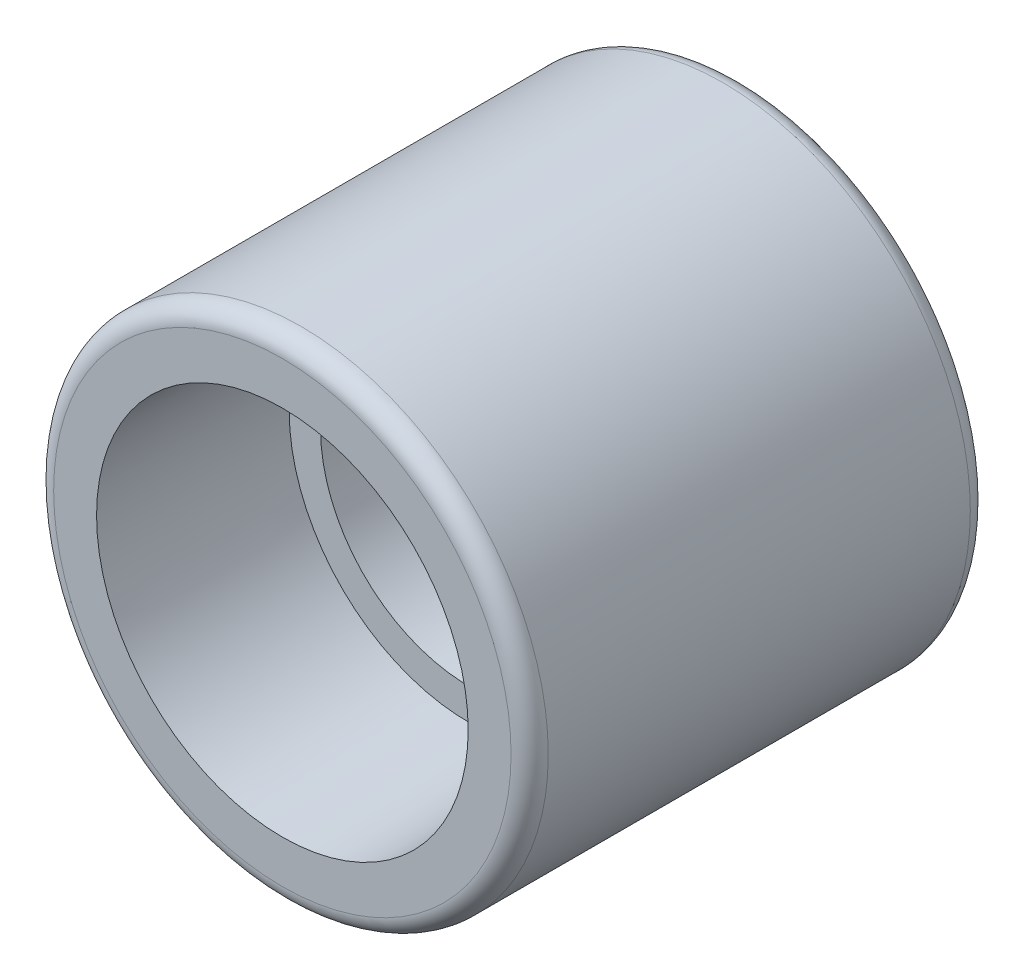
from build123d import *

# Parameters (mm, degrees)
BODYSCH_R  = 22.225
BODY_DEPTH = 41.275
FLOWSCH_R  = 13.3604
FLOW_DEPTH = 31.75
FILLET1_R  = 1.67005


with BuildPart() as part:
    # BodySch → Body (new body)
    with BuildSketch(Plane.XY):
        Circle(BODYSCH_R)
    extrude(amount=BODY_DEPTH)

    # FlowSch → Flow (cut)
    with BuildSketch(Plane.XY.offset(41.275)):
        Circle(FLOWSCH_R)
    extrude(amount=-FLOW_DEPTH, mode=Mode.SUBTRACT)

    # ThreadSch → Thread (revolve, cut)
    with BuildSketch(Plane(origin=(0, 0, 0), x_dir=(0, 0, -1), z_dir=(1, 0, 0))):
        Polygon((-24.4856, 0), (-24.4856, 16.177760476), (-41.275, 16.7005), (-41.275, 0), align=None)
    revolve(axis=Axis((0, 0, 0), (0, 0, 1)), mode=Mode.SUBTRACT)

    # Fillet1
    fillet1_edges = [part.edges().sort_by_distance(p)[0] for p in [
        (-22.225, 0, 41.275),
        (-22.225, 0, 0),
    ]]
    fillet(fillet1_edges, radius=FILLET1_R)


solid = part.part
